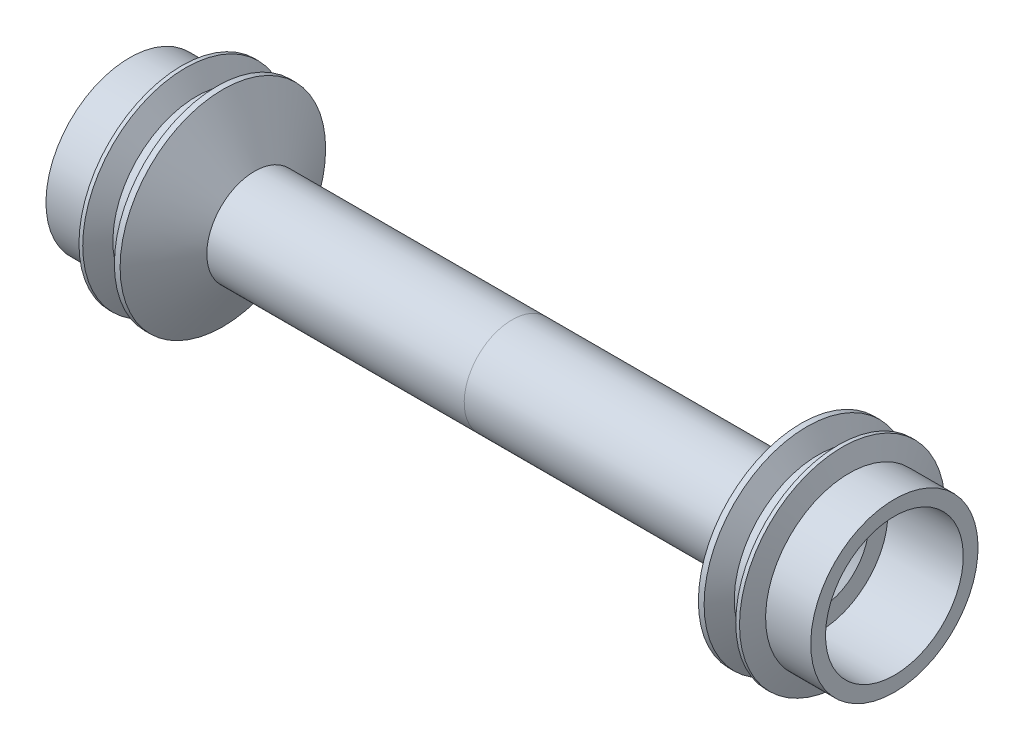
from build123d import *

# Parameters (mm, degrees)
CHAMFER1_SIZE = 0.508


with BuildPart() as part:
    # Sketch2 → Revolve1 (revolve)
    with BuildSketch(Plane.XY):
        Polygon((-22.4, 5.55625), (-25.4, 5.55625), (-25.4, 4.575), (-20.4, 4.575), (-20.4, 3.305), (-19.892, 2.797), (-19.892, 1.7145), (-15.575, 1.7145), (-15.575, 0), (-14.1, 0), (-12.5, 1.6), (0, 1.6), (0, 3.175), (-17.097714988, 3.175), (-19.205765158, 6.82625), (-19.586765158, 6.82625), (-20.32, 5.55625), (-20.955, 5.55625), (-21.688234842, 6.82625), (-21.937757802, 6.82625), align=None)
    revolve(axis=Axis((-25.4, 0, 0), (1, 0, 0)))


with BuildPart() as body_2:
    # Mirror1: mirrored copy
    add(part.part.mirror(Plane(origin=(0, 0, 0), x_dir=(0, 0, 1), z_dir=(1, 0, 0))))


with BuildPart() as part_1:
    add(part.part)

    # Chamfer1
    chamfer1_edges = [part_1.edges().sort_by_distance(p)[0] for p in [
        (-25.4, -4.575, 0),
    ]]
    chamfer(chamfer1_edges, length=CHAMFER1_SIZE)


solid = Compound([body_2.part, part_1.part])
